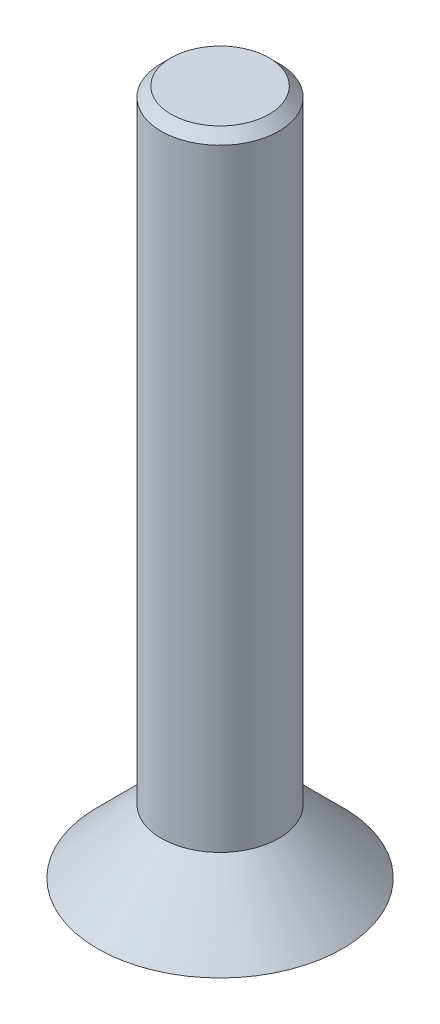
from build123d import *

# Parameters (mm, degrees)
SKETCH_1_R      = 2.5
EXTRUDE_1_DEPTH = 1.3
CHAMFER_1_SIZE  = 1.3
SKETCH_2_R      = 1.2
EXTRUDE_2_DEPTH = 12.7
CHAMFER_2_SIZE  = 0.2


with BuildPart() as part:
    # 草图1 → 凸台-拉伸1 (new body)
    with BuildSketch(Plane(origin=(0, 0, 0), x_dir=(1, 0, 0), z_dir=(0, 1, 0))):
        with Locations(Location((0, 0, 0), (0, 0, 270))):
            Circle(SKETCH_1_R)
        Polygon((0, -0.866025404), (0.75, -0.433012702), (0.75, 0.433012702), (0, 0.866025404), (-0.75, 0.433012702), (-0.75, -0.433012702), align=None, mode=Mode.SUBTRACT)
    extrude(amount=EXTRUDE_1_DEPTH)

    # 倒角1
    # the kernel refuses this chamfer: 1.3 mm, written as the material it takes off along each edge
    with BuildSketch(Plane(origin=(0, 1.3, 0), x_dir=(0, 0, 1), z_dir=(-1, 0, 0))) as chamfer_1_piece_1:
        Polygon((2.5, -CHAMFER_1_SIZE), (2.5 - CHAMFER_1_SIZE, 0), (2.5, 0), align=None)
    revolve(axis=Axis((0, 1.3, 0), (0, 1, 0)), mode=Mode.SUBTRACT)

    # 草图2 → 凸台-拉伸2 (add)
    with BuildSketch(Plane(origin=(0, 1.3, 0), x_dir=(1, 0, 0), z_dir=(0, 1, 0))):
        with Locations(Location((0, 0, 0), (0, 0, 270))):
            Circle(SKETCH_2_R)
    extrude(amount=EXTRUDE_2_DEPTH)

    # 倒角2
    chamfer_2_edges = [part.edges().sort_by_distance(p)[0] for p in [
        (0, 14, -1.2),
    ]]
    chamfer(chamfer_2_edges, length=CHAMFER_2_SIZE)


solid = part.part
